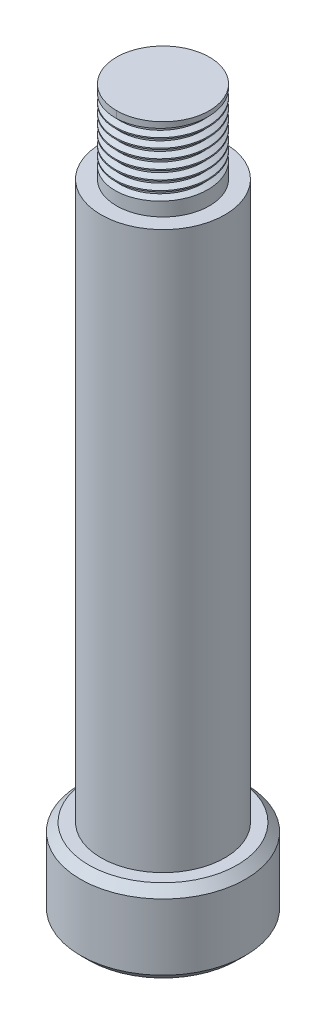
from build123d import *

# Parameters (mm, degrees)
SKETCH2_R           = 12.7
BOSS_EXTRUDE1_DEPTH = 12.7
SKETCH3_R           = 9.525
BOSS_EXTRUDE2_DEPTH = 98.425
CUT_EXTRUDE1_START  = -12.7
SKETCH9_R           = 12.7
SKETCH9_R_2         = 7.14375
CUT_EXTRUDE1_DEPTH  = 12.7
THREAD2_PITCH       = 1.411111111
CHAMFER1_SIZE       = 1.27
CHAMFER2_SIZE       = 1.27
CUT_EXTRUDE2_DEPTH  = 9.525


with BuildPart() as part:
    # Sketch2 → Boss-Extrude1 (new body)
    with BuildSketch(Plane(origin=(0, 0, 0), x_dir=(1, 0, 0), z_dir=(0, 1, 0))):
        with Locations(Location((0, 0, 0), (0, 0, 270))):
            Circle(SKETCH2_R)
    extrude(amount=BOSS_EXTRUDE1_DEPTH)

    # Sketch3 → Boss-Extrude2 (add)
    with BuildSketch(Plane(origin=(0, 12.7, 0), x_dir=(1, 0, 0), z_dir=(0, 1, 0))):
        with Locations(Location((0, 0, 0), (0, 0, 270))):
            Circle(SKETCH3_R)
    extrude(amount=BOSS_EXTRUDE2_DEPTH)

    # Sketch9 → Cut-Extrude1 (cut)
    with BuildSketch(Plane(origin=(0, 111.125, 0), x_dir=(1, 0, 0), z_dir=(0, 1, 0)).offset(CUT_EXTRUDE1_START)):
        with Locations(Location((0, 0, 0), (0, 0, 270))):
            Circle(SKETCH9_R)
        with Locations(Location((0, 0, 0), (0, 0, 270))):
            Circle(SKETCH9_R_2, mode=Mode.SUBTRACT)
    extrude(amount=CUT_EXTRUDE1_DEPTH, mode=Mode.SUBTRACT)

    # Thread2: the profile of Thread Profile2 profile screwed along a right-hand helix of 7.086614 turns, 8 arcs to a turn; built about Z, then put on its axis
    thread2_z = Axis((0, 0, 0), (0, 0, 1))
    thread2_corners = [(7.14405, 0, -0.000173205), (7.14405, 0, 1.234895423), (6.37996371, 0, 0.793749998), (6.37996371, 0, 0.44097222)]
    with BuildLine(mode=Mode.PRIVATE) as thread2_profile:
        Line(thread2_corners[0], thread2_corners[1])
        Line(thread2_corners[1], thread2_corners[2])
        Line(thread2_corners[2], thread2_corners[3])
        Line(thread2_corners[3], thread2_corners[0])
    thread2_cap = Face(thread2_profile.wire())
    thread2_turn_angles = [0, 22.5, 45, 67.5, 90, 112.5, 135, 157.5, 180, 202.5, 225, 247.5, 270, 292.5, 315, 337.5, 360]
    thread2_turn_weights = [1, 0.9238795325112867, 1, 0.9238795325112867, 1, 0.9238795325112867, 1, 0.9238795325112867, 1, 0.9238795325112867, 1, 0.9238795325112867, 1, 0.9238795325112867, 1, 0.9238795325112867, 1]
    thread2_turn_rails = [Edge.make_bspline([Vector(p[0], p[1], 0).rotate(thread2_z, thread2_turn_angles[k]) / thread2_turn_weights[k] + Vector(0, 0, p[2] + THREAD2_PITCH * thread2_turn_angles[k] / 360) for k in range(17)], [0, 0, 0, 1, 1, 2, 2, 3, 3, 4, 4, 5, 5, 6, 6, 7, 7, 8, 8, 8], 2, thread2_turn_weights) for p in thread2_corners]
    thread2_turn_sides = [Face.make_surface_from_curves(thread2_turn_rails[p[0]], thread2_turn_rails[p[1]]) for p in [(0, 1), (1, 2), (2, 3), (3, 0)]]
    thread2_last_angles = [2520, 2535.590551181, 2551.181102362]
    thread2_last_weights = [1, 0.9632069020746566, 1]
    thread2_last_rails = [Edge.make_bspline([Vector(p[0], p[1], 0).rotate(thread2_z, thread2_last_angles[k]) / thread2_last_weights[k] + Vector(0, 0, p[2] + THREAD2_PITCH * thread2_last_angles[k] / 360) for k in range(3)], [0, 0, 0, 1, 1, 1], 2, thread2_last_weights) for p in thread2_corners]
    thread2_last_sides = [Face.make_surface_from_curves(thread2_last_rails[p[0]], thread2_last_rails[p[1]]) for p in [(0, 1), (1, 2), (2, 3), (3, 0)]]
    thread2 = Plane(origin=(0, 111.125, 0), x_dir=(-1, 0, 0), z_dir=(0, -1, 0)) * Solid(Shell([*[p.moved(Location((0, 0, THREAD2_PITCH * i))) for i in range(7) for p in thread2_turn_sides], *thread2_last_sides, thread2_cap, thread2_cap.rotate(thread2_z, 2551.181102362).moved(Location((0, 0, THREAD2_PITCH * 2551.181102362 / 360)))]))
    add(thread2, mode=Mode.SUBTRACT)

    # Chamfer1
    chamfer1_edges = [part.edges().sort_by_distance(p)[0] for p in [
        (0, 0, -12.7),
    ]]
    chamfer(chamfer1_edges, length=CHAMFER1_SIZE)

    # Chamfer2
    chamfer2_edges = [part.edges().sort_by_distance(p)[0] for p in [
        (0, 12.7, -12.7),
    ]]
    chamfer(chamfer2_edges, length=CHAMFER2_SIZE)

    # Sketch10 → Cut-Extrude2 (cut)
    with BuildSketch(Plane.XZ):
        Polygon((0, 5.499261314), (-4.7625, 2.749630657), (-4.7625, -2.749630657), (0, -5.499261314), (4.7625, -2.749630657), (4.7625, 2.749630657), align=None)
    extrude(amount=-CUT_EXTRUDE2_DEPTH, mode=Mode.SUBTRACT)


solid = part.part
